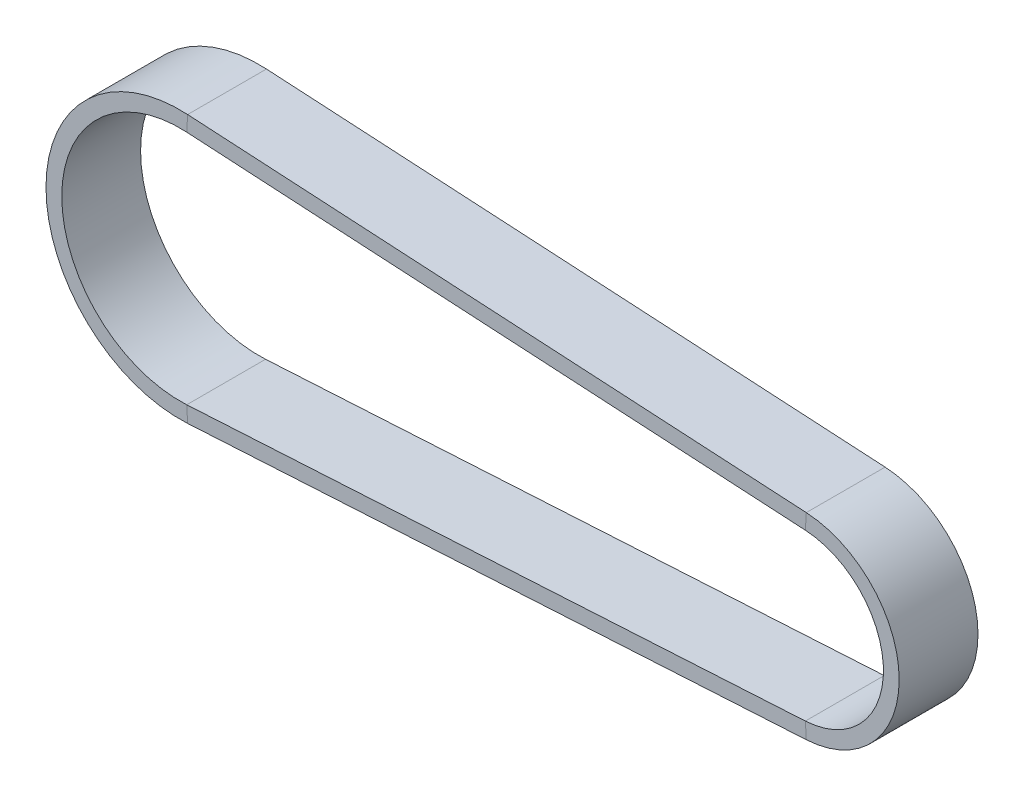
from build123d import *
from build123d.topology import SkipClean

# Parameters (mm, degrees)
SKIZZE2_W = 2
SKIZZE2_H = 10


with BuildPart() as part:
    # Austragung1: sweep along a path in Skizze3
    with BuildLine(Plane.XY.offset(15.5)) as austragung1_path:
        ThreePointArc((89.75, 0), (86.74732098, 7.552672186), (79.378571429, 10.982026132))
        Line((79.378571429, 10.982026132), (0.885714286, 15.474673186))
        ThreePointArc((0.885714286, 15.474673186), (-10.642401716, 11.26895229), (-15.5, 0))
    # Skizze2 → Austragung1 (sweep)
    with BuildSketch(Plane(origin=(0, 0, 0), x_dir=(1, 0, 0), z_dir=(0, 1, 0))):
        with Locations((-16, -15.5)):
            Rectangle(SKIZZE2_W, SKIZZE2_H)
    sweep(path=austragung1_path.line)

    # Spiegeln1: part across plane


with BuildPart() as part_1:
    with SkipClean():  # the faces are left unmerged after this step: merging them gives an invalid solid
        add(part.part)
        add(part.part.mirror(Plane(origin=(0, 0, 0), x_dir=(0, 0, 1), z_dir=(0, -1, 0))))


solid = part_1.part
